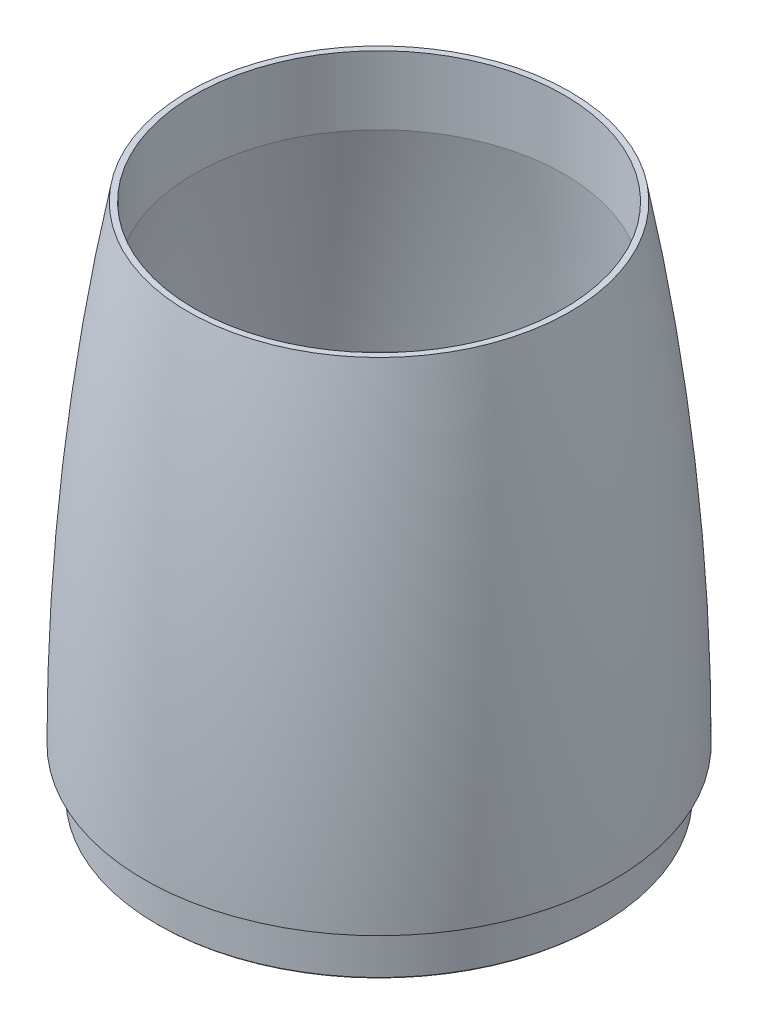
from build123d import *

# Parameters (mm, degrees)
CHAMFER1_SIZE = 0.25


with BuildPart() as part:
    # Sketch1 → Revolve1 (revolve)
    with BuildSketch(Plane.XY):
        with BuildLine():
            Line((-32.5, 80), (-31.5, 80))
            Line((-31.5, 80), (-31.5, 68.347153074))
            ThreePointArc((-31.5, 68.347153074), (-34.000163087, 50.550584229), (-35.75, 32.664647046))
            Line((-35.75, 32.664647046), (-35.75, -8))
            Line((-35.75, -8), (-37.75, -8))
            Line((-37.75, -8), (-37.75, 0))
            Line((-37.75, 0), (-40, 0))
            ThreePointArc((-40, 0), (-38.120898133, 40.1753967), (-32.5, 80))
        make_face()
    revolve(axis=Axis((0, -1572.02612714, 0), (0, 1, 0)))

    # Chamfer1
    chamfer1_edges = [part.edges().sort_by_distance(p)[0] for p in [
        (37.75, -8, 0),
        (35.75, -8, 0),
    ]]
    chamfer(chamfer1_edges, length=CHAMFER1_SIZE)


solid = part.part
